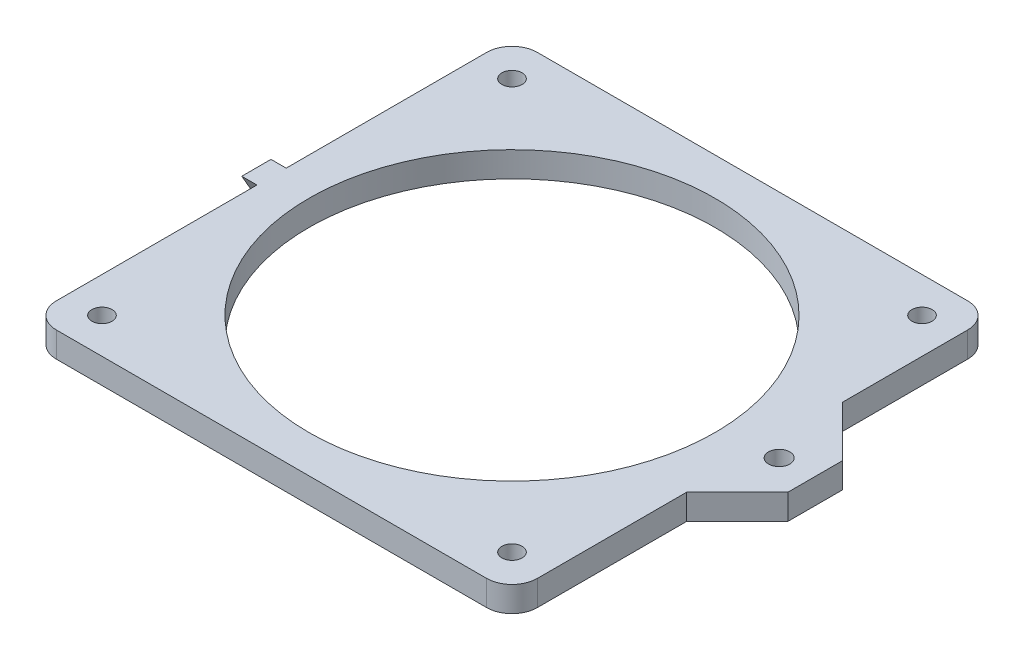
from build123d import *

# Parameters (mm, degrees)
SKETCH1_W                       = 95
SKETCH1_H                       = 95
SKETCH1_W_2                     = 81
SKETCH1_H_2                     = 81
SKETCH1_R                       = 40.1
BOSS_EXTRUDE1_DEPTH             = 5
F_4_0MM_DOWEL_HOLE1_D           = 4
BOSS_EXTRUDE2_DEPTH             = 3
FILLET1_R                       = 5
SKETCH6_W                       = 3
SKETCH6_H                       = 5
SKETCH6_W_2                     = 4.8
BOSS_EXTRUDE3_DEPTH             = 10
TAP_DRILL_FOR_M5X0_8_TAP1_D     = 4.2
TAP_DRILL_FOR_M5X0_8_TAP1_DEPTH = 12
TAP_DRILL_FOR_M5X0_8_TAP1_TIP   = 1.2618073
CHAMFER1_SIZE                   = 10


with BuildPart() as part:
    # Sketch1 → Boss-Extrude1 (new body)
    # profile 1 of 2: a face of its own
    with BuildSketch(Plane(origin=(0, 0, 0), x_dir=(1, 0, 0), z_dir=(0, 1, 0))):
        Rectangle(SKETCH1_W, SKETCH1_H)
        Rectangle(SKETCH1_W_2, SKETCH1_H_2, mode=Mode.SUBTRACT)
    # profile 2 of 2: a face of its own
    with BuildSketch(Plane(origin=(0, 0, 0), x_dir=(1, 0, 0), z_dir=(0, 1, 0))):
        Rectangle(SKETCH1_W_2, SKETCH1_H_2)
        with Locations(Location((0, 0, 0), (0, 0, 270))):
            Circle(SKETCH1_R, mode=Mode.SUBTRACT)
    extrude(amount=BOSS_EXTRUDE1_DEPTH)

    # Ø4.0mm Dowel Hole1 (through all)
    with Locations(Plane(origin=(0, 0, 0), x_dir=(-1, 0, 0), z_dir=(0, -1, 0))):
        with Locations((40.5, -40.5), (-40.5, -40.5), (-40.5, 40.5), (40.5, 40.5)):
            Hole(F_4_0MM_DOWEL_HOLE1_D / 2)

    # Sketch5 → Boss-Extrude2 (add)
    with BuildSketch(Plane.ZY.offset(47.5)):
        Polygon((0, 0), (-2.886751346, 5), (2.886751346, 5), align=None)
    extrude(amount=BOSS_EXTRUDE2_DEPTH)

    # Fillet1
    fillet1_edges = [part.edges().sort_by_distance(p)[0] for p in [
        (-47.5, 2.5, 47.5),
        (-47.5, 2.5, -47.5),
        (47.5, 2.5, -47.5),
        (47.5, 2.5, 47.5),
    ]]
    fillet(fillet1_edges, radius=FILLET1_R)

    # Sketch6 → Boss-Extrude3 (add)
    with BuildSketch(Plane(origin=(47.5, 0, 0), x_dir=(0, 0, -1), z_dir=(1, 0, 0))):
        with Locations((-1.5, 2.5)):
            Rectangle(SKETCH6_W, SKETCH6_H)
        with Locations((2.4, 2.5)):
            Rectangle(SKETCH6_W_2, SKETCH6_H)
        with Locations((6.3, 2.5)):
            Rectangle(SKETCH6_W, SKETCH6_H)
    extrude(amount=BOSS_EXTRUDE3_DEPTH)

    # Tap Drill for M5x0.8 Tap1
    with Locations(Plane(origin=(0, 5, 0), x_dir=(1, 0, 0), z_dir=(0, 1, 0))):
        with Locations((50.782954503, 2)):
            Hole(TAP_DRILL_FOR_M5X0_8_TAP1_D / 2, depth=TAP_DRILL_FOR_M5X0_8_TAP1_DEPTH)
            with Locations((0, 0, -(TAP_DRILL_FOR_M5X0_8_TAP1_DEPTH + TAP_DRILL_FOR_M5X0_8_TAP1_TIP / 2))):  # 118° drill point
                Cone(0, TAP_DRILL_FOR_M5X0_8_TAP1_D / 2, TAP_DRILL_FOR_M5X0_8_TAP1_TIP, mode=Mode.SUBTRACT)

    # Chamfer1
    chamfer1_edges = [part.edges().sort_by_distance(p)[0] for p in [
        (47.5, 2.5, 3),
        (47.5, 2.5, -7.8),
    ]]
    chamfer(chamfer1_edges, length=CHAMFER1_SIZE - 0.0001)  # a hair under: the kernel refuses the full size


solid = part.part
